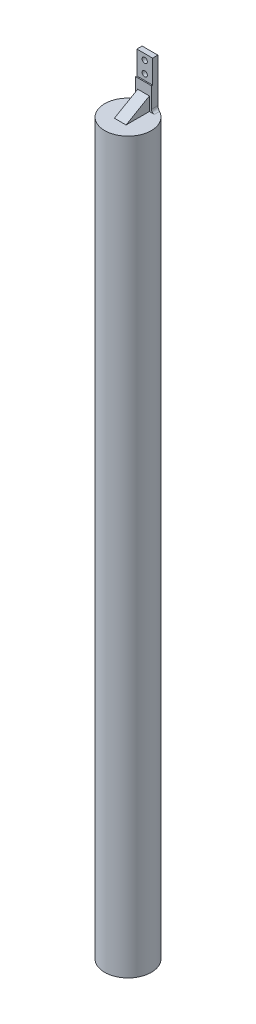
from build123d import *

# Parameters (mm, degrees)
SKETCH1_W              = 2.7
SKETCH1_H              = 1.1
BOSS_EXTRUDE1_DEPTH    = 4
SKETCH2_W              = 2.7
SKETCH2_H              = 0.9
BOSS_EXTRUDE2_DEPTH    = 4
SKETCH3_W              = 2.7
SKETCH3_H              = 1.1
LENGHT_EXTRUSION_DEPTH = 125
BOSS_EXTRUDE4_DEPTH    = 1
FILLET8_R              = 0.5
SKETCH7_R              = 0.45
CUT_EXTRUDE1_DEPTH     = 0.9


with BuildPart() as part:
    # Sketch1 → Boss-Extrude1 (new body)
    with BuildSketch(Plane(origin=(0, 0, 0), x_dir=(1, 0, 0), z_dir=(0, 1, 0))):
        Rectangle(SKETCH1_W, SKETCH1_H)
    extrude(amount=BOSS_EXTRUDE1_DEPTH)

    # Sketch2 → Boss-Extrude2 (add)
    with BuildSketch(Plane(origin=(0, 4, 0), x_dir=(1, 0, 0), z_dir=(0, 1, 0))):
        with Locations((0, 0.1)):
            Rectangle(SKETCH2_W, SKETCH2_H)
    extrude(amount=BOSS_EXTRUDE2_DEPTH)

    # Sketch3 → lenght extrusion (add)
    with BuildSketch(Plane.XZ):
        with BuildLine():
            ThreePointArc((4, 3.215302113), (-2.302172887, 6.486387559), (-1.35, -0.55))
            Line((-1.35, -0.55), (-1.35, 0.55))
            Line((-1.35, 0.55), (1.35, 0.55))
            Line((1.35, 0.55), (1.35, -0.55))
            ThreePointArc((1.35, -0.55), (3.271085447, 0.913129226), (4, 3.215302113))
        make_face()
        Rectangle(SKETCH3_W, SKETCH3_H)
    extrude(amount=LENGHT_EXTRUSION_DEPTH)

    # Sketch6 → Boss-Extrude4 (add, symmetric)
    with BuildSketch(Plane(origin=(0, 0, 0), x_dir=(0, 0, -1), z_dir=(1, 0, 0))):
        Polygon((-0.55, 2.309401077), (-4.55, 0), (-0.55, 0), align=None)
    extrude(amount=BOSS_EXTRUDE4_DEPTH, both=True)

    # Fillet8
    # the kernel refuses this fillet: 0.5 mm, written as the material it adds along each edge
    with BuildSketch(Plane(origin=(-1.35, 0, 0.55), x_dir=(0, 1, 0), z_dir=(0, 0, -1))) as fillet8_piece_1_section:
        with BuildLine():
            CenterArc((FILLET8_R, -FILLET8_R), FILLET8_R, 90, 90)
            Line((0, -FILLET8_R), (0, 0))
            Line((0, 0), (FILLET8_R, 0))
        make_face()
    fillet8_piece_1 = extrude(amount=1.1, mode=Mode.PRIVATE)
    fillet8_piece_1 = fillet8_piece_1 & Plane(origin=(0, 0.115807934, 3.215302113), x_dir=(1, 0, 0), z_dir=(0, 1, 0)) * Cylinder(4, 5, mode=Mode.PRIVATE)
    add(fillet8_piece_1)
    with BuildSketch(Plane(origin=(1.35, 0, -0.55), x_dir=(0, 1, 0), z_dir=(0, 0, 1))) as fillet8_piece_2_section:
        with BuildLine():
            CenterArc((FILLET8_R, -FILLET8_R), FILLET8_R, 90, 90)
            Line((0, -FILLET8_R), (0, 0))
            Line((0, 0), (FILLET8_R, 0))
        make_face()
    fillet8_piece_2 = extrude(amount=1.1, mode=Mode.PRIVATE)
    fillet8_piece_2 = fillet8_piece_2 & Plane(origin=(0, 0.11580798, 3.215302113), x_dir=(1, 0, 0), z_dir=(0, 1, 0)) * Cylinder(4, 5, mode=Mode.PRIVATE)
    add(fillet8_piece_2)

    # Sketch7 → Cut-Extrude1 (cut)
    with BuildSketch(Plane.XY.offset(0.35)):
        with Locations((0, 5)):
            Circle(SKETCH7_R)
        with Locations((0, 7)):
            Circle(SKETCH7_R)
    extrude(amount=-CUT_EXTRUDE1_DEPTH, mode=Mode.SUBTRACT)


solid = part.part
